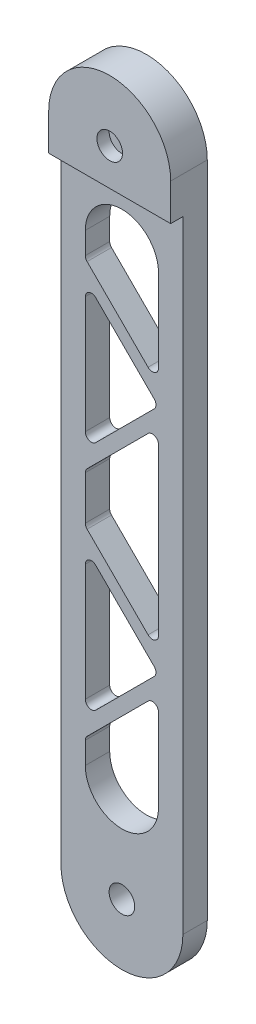
from build123d import *

# Parameters (mm, degrees)
CROQUIS1_R              = 2.1
SALIENTE_EXTRUIR1_DEPTH = 4
CROQUIS1_6_R            = 2.1
SALIENTE_EXTRUIR3_DEPTH = 6
REDONDEO1_R             = 1


with BuildPart() as part:
    # Croquis1 → Saliente-Extruir1 (new body)
    with BuildSketch(Plane.XY):
        with BuildLine():
            ThreePointArc((10, 54), (0, 64), (-10, 54))
            Line((-10, 54), (-10, -54))
            ThreePointArc((-10, -54), (0, -64), (10, -54))
            Line((10, -54), (10, 54))
        make_face()
        with BuildLine():
            Line((6, 38), (6, 22))
            Line((6, 22), (-6, 34))
            Line((-6, 34), (-6, 38))
            ThreePointArc((-6, 38), (0, 44), (6, 38))
        make_face(mode=Mode.SUBTRACT)
        Polygon((-6, 7), (-6, 31), (6, 19), align=None, mode=Mode.SUBTRACT)
        Polygon((-6, -4), (-6, 4), (6, 16), (6, -16), align=None, mode=Mode.SUBTRACT)
        Polygon((-6, -31), (-6, -7), (6, -19), align=None, mode=Mode.SUBTRACT)
        with BuildLine():
            Line((-6, -38), (-6, -34))
            Line((-6, -34), (6, -22))
            Line((6, -22), (6, -38))
            ThreePointArc((6, -38), (0, -44), (-6, -38))
        make_face(mode=Mode.SUBTRACT)
        with Locations((0, -54)):
            Circle(CROQUIS1_R, mode=Mode.SUBTRACT)
    extrude(amount=SALIENTE_EXTRUIR1_DEPTH)

    # Croquis1<6> → Saliente-Extruir3 (add)
    with BuildSketch(Plane.XY):
        with BuildLine():
            Line((10, 47.95), (10, 54))
            ThreePointArc((10, 54), (0, 64), (-10, 54))
            Line((-10, 54), (-10, 47.95))
            Line((-10, 47.95), (10, 47.95))
        make_face()
        with Locations((0, 54)):
            Circle(CROQUIS1_6_R, mode=Mode.SUBTRACT)
    extrude(amount=SALIENTE_EXTRUIR3_DEPTH)

    # Redondeo1
    redondeo1_edges = [part.edges().sort_by_distance(p)[0] for p in [
        (6, 22, 2),
        (6, 16, 2),
        (6, 19, 2),
        (-6, 31, 2),
        (-6, 7, 2),
        (6, -22, 2),
        (6, -16, 2),
        (6, -19, 2),
        (-6, -31, 2),
        (-6, -7, 2),
        (-6, 34, 2),
        (-6, -4, 2),
        (-6, -34, 2),
        (-6, 4, 2),
    ]]
    fillet(redondeo1_edges, radius=REDONDEO1_R)


solid = part.part
